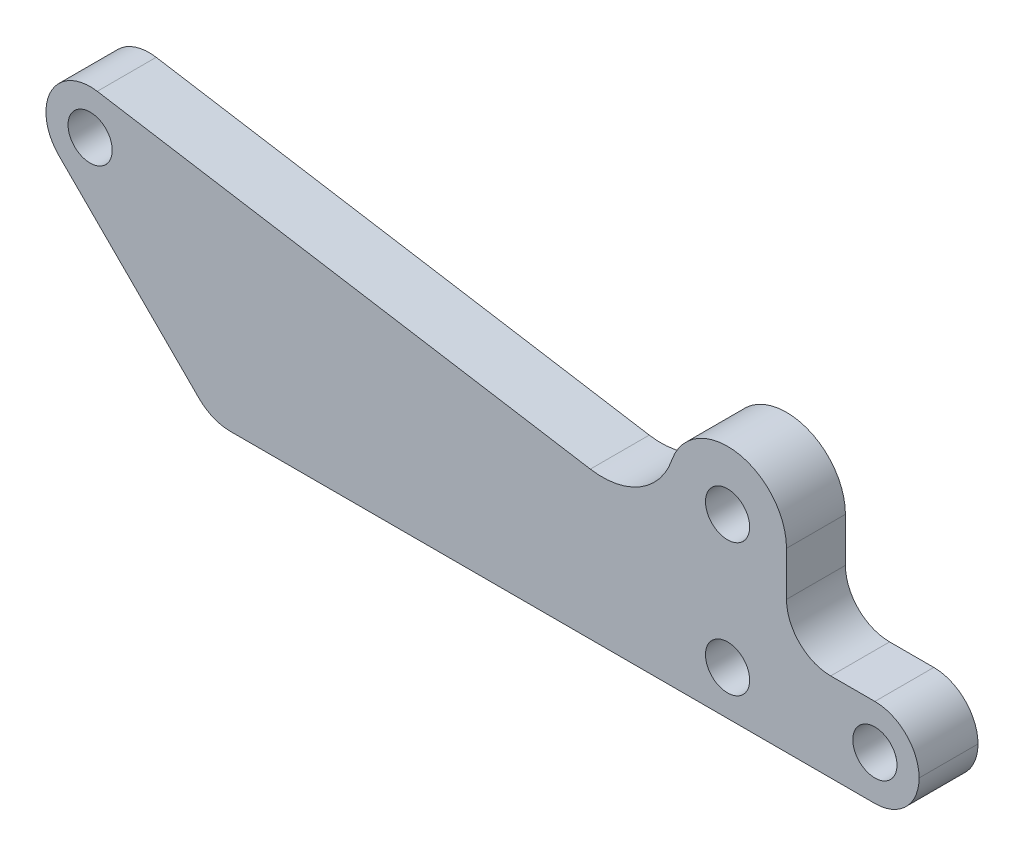
from build123d import *

# Parameters (mm, degrees)
SKETCH1_R           = 1.5
BOSS_EXTRUDE1_DEPTH = 4
FILLET1_R           = 3


with BuildPart() as part:
    # Sketch1 → Boss-Extrude1 (new body)
    with BuildSketch(Plane.XY):
        with BuildLine():
            Line((0, 0), (48, 0))
            Line((48, 0), (48, 6))
            Line((48, 6), (39, 6))
            Line((39, 6), (39, 12))
            ThreePointArc((39, 12), (35.661193516, 15.944974415), (31.218588433, 13.304195753))
            ThreePointArc((31.218588433, 13.304195753), (29.055123964, 10.641481887), (25.684793917, 10))
            Line((25.684793917, 10), (-7.786766468, 15.474289455))
            ThreePointArc((-7.786766468, 15.474289455), (-10.94056647, 13.882322422), (-10.392304845, 10.392304845))
            Line((-10.392304845, 10.392304845), (0, 0))
        make_face()
        with Locations((35, 12)):
            Circle(SKETCH1_R, mode=Mode.SUBTRACT)
        with Locations((-8.270984502, 12.513625189)):
            Circle(SKETCH1_R, mode=Mode.SUBTRACT)
        with Locations((35, 3)):
            Circle(SKETCH1_R, mode=Mode.SUBTRACT)
        with Locations((45, 3)):
            Circle(SKETCH1_R, mode=Mode.SUBTRACT)
    extrude(amount=BOSS_EXTRUDE1_DEPTH)

    # Fillet1
    fillet1_edges = [part.edges().sort_by_distance(p)[0] for p in [
        (48, 0, 2),
        (48, 6, 2),
        (39, 6, 2),
        (0, 0, 2),
    ]]
    fillet(fillet1_edges, radius=FILLET1_R - 0.0001)  # a hair under: the kernel refuses the full size


solid = part.part
